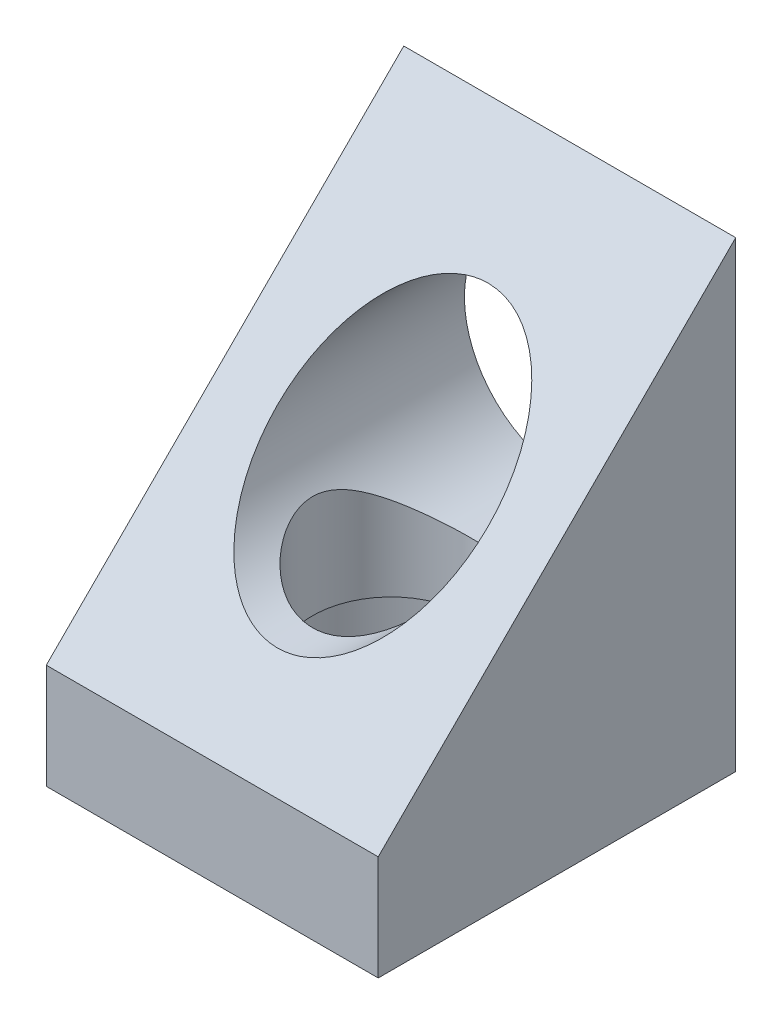
from build123d import *

# Parameters (mm, degrees)
BOSS_EXTRUDE1_DEPTH = 26
SKETCH2_R           = 8.25
CUT_EXTRUDE1_DEPTH  = 53.64872648
SKETCH3_R           = 6.15
CUT_EXTRUDE2_DEPTH  = 53.64872648
SKETCH4_R           = 10.325
SKETCH4_R_2         = 1.25
CUT_EXTRUDE3_DEPTH  = 8


with BuildPart() as part:
    # Sketch1 → Boss-Extrude1 (new body)
    with BuildSketch(Plane(origin=(0, 0, 0), x_dir=(0, 0, -1), z_dir=(1, 0, 0))):
        Polygon((0, 0), (28, 0), (28, 36.22), (0, 8.22), align=None)
    extrude(amount=BOSS_EXTRUDE1_DEPTH)

    # Sketch2 → Cut-Extrude1 (cut, through all)
    with BuildSketch(Plane(origin=(0, 0, -28), x_dir=(-1, 0, 0), z_dir=(0, 0, -1))):
        with Locations((-13, 21.58)):
            Circle(SKETCH2_R)
    extrude(amount=-CUT_EXTRUDE1_DEPTH, mode=Mode.SUBTRACT)

    # Sketch3 → Cut-Extrude2 (cut, through all)
    with BuildSketch(Plane.XZ):
        with Locations((13, -14)):
            Circle(SKETCH3_R)
    extrude(amount=-CUT_EXTRUDE2_DEPTH, mode=Mode.SUBTRACT)

    # Sketch4 → Cut-Extrude3 (cut)
    with BuildSketch(Plane.XZ):
        with Locations((13, -14)):
            Circle(SKETCH4_R)
        with Locations((3.9, -3.85)):
            Circle(SKETCH4_R_2)
        with Locations((23.05, -3.75)):
            Circle(SKETCH4_R_2)
        with Locations((22.85, -22.95)):
            Circle(SKETCH4_R_2)
        with Locations((3.7, -22.65)):
            Circle(SKETCH4_R_2)
    extrude(amount=-CUT_EXTRUDE3_DEPTH, mode=Mode.SUBTRACT)


solid = part.part
